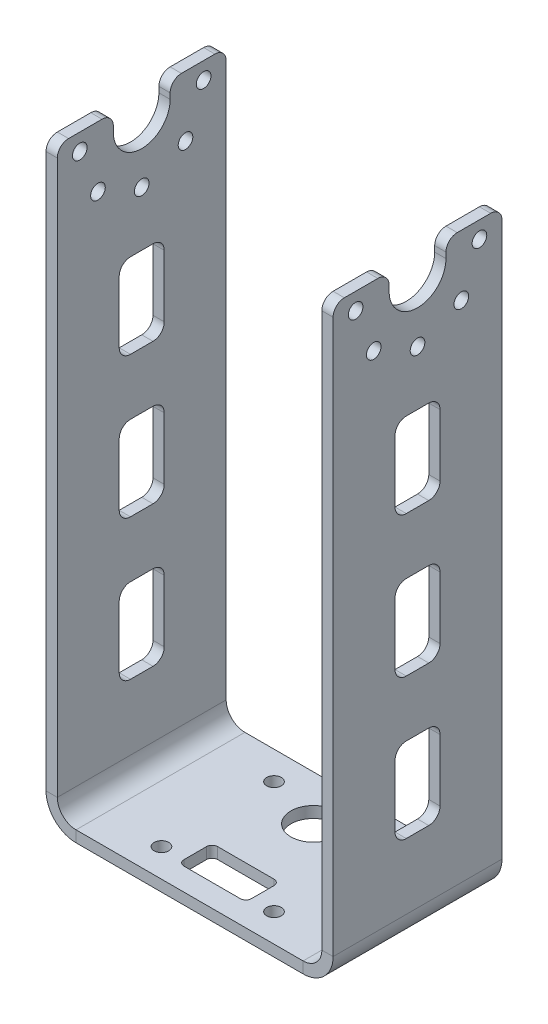
from build123d import *

# Parameters (mm, degrees)
BASE_FLANGE1_DEPTH      = 15
CUT_EXTRUDE1_DEPTH      = 10
CUT_EXTRUDE2_DEPTH      = 108.837563029
CUT_EXTRUDE2_DEPTH_BACK = 108.837563029
SKETCH6_R               = 1.3
SKETCH8_R               = 4
SKETCH8_W               = 12
SKETCH8_H               = 6
CUT_EXTRUDE4_DEPTH      = 10
CUT_EXTRUDE5_DEPTH      = 108.837563029
CUT_EXTRUDE5_DEPTH_BACK = 108.837563029
FILLET1_R               = 2
FILLET2_R               = 1


# Sheet-metal steps are written as plain solids
with BuildPart() as part:
    # Sketch1 → Base-Flange1 (new, symmetric)
    with BuildSketch(Plane.XY):
        with BuildLine():
            Line((-23.5, 103.7), (-23.5, 3.33))
            ThreePointArc((-23.5, 3.33), (-22.524665581, 0.975334419), (-20.17, 0))
            Line((-20.17, 0), (20.17, 0))
            ThreePointArc((20.17, 0), (22.524665581, 0.975334419), (23.5, 3.33))
            Line((23.5, 3.33), (23.5, 103.7))
            Line((23.5, 103.7), (25.5, 103.7))
            Line((25.5, 103.7), (25.5, 3.33))
            ThreePointArc((25.5, 3.33), (23.938879144, -0.438879144), (20.17, -2))
            Line((20.17, -2), (-20.17, -2))
            ThreePointArc((-20.17, -2), (-23.938879144, -0.438879144), (-25.5, 3.33))
            Line((-25.5, 3.33), (-25.5, 103.7))
            Line((-25.5, 103.7), (-23.5, 103.7))
        make_face()
    extrude(amount=BASE_FLANGE1_DEPTH, both=True)

    # Sketch5 → Cut-Extrude1 (cut)
    with BuildSketch(Plane.XZ.offset(2)):
        with BuildLine():
            Line((-10, 8.7), (-10, 10))
            Line((-10, 10), (-8.7, 10))
            ThreePointArc((-8.7, 10), (-10.919238816, 10.919238816), (-10, 8.7))
        make_face()
        with BuildLine():
            Line((-8.7, 10), (-10, 10))
            Line((-10, 10), (-10, 8.7))
            ThreePointArc((-10, 8.7), (-9.080761184, 9.080761184), (-8.7, 10))
        make_face()
        with BuildLine():
            ThreePointArc((11.3, 10), (10, 11.3), (8.7, 10))
            Line((8.7, 10), (10, 10))
            Line((10, 10), (10, 8.7))
            ThreePointArc((10, 8.7), (10.919238816, 9.080761184), (11.3, 10))
        make_face()
        with BuildLine():
            Line((10, 10), (8.7, 10))
            ThreePointArc((8.7, 10), (9.080761184, 9.080761184), (10, 8.7))
            Line((10, 8.7), (10, 10))
        make_face()
        with BuildLine():
            ThreePointArc((11.3, -10), (10.919238816, -9.080761184), (10, -8.7))
            Line((10, -8.7), (10, -10))
            Line((10, -10), (8.7, -10))
            ThreePointArc((8.7, -10), (10, -11.3), (11.3, -10))
        make_face()
        with BuildLine():
            Line((10, -10), (10, -8.7))
            ThreePointArc((10, -8.7), (9.080761184, -9.080761184), (8.7, -10))
            Line((8.7, -10), (10, -10))
        make_face()
        with BuildLine():
            ThreePointArc((-8.7, -10), (-9.080761184, -9.080761184), (-10, -8.7))
            Line((-10, -8.7), (-10, -10))
            Line((-10, -10), (-8.7, -10))
        make_face()
        with BuildLine():
            Line((-10, -10), (-10, -8.7))
            ThreePointArc((-10, -8.7), (-10.919238816, -10.919238816), (-8.7, -10))
            Line((-8.7, -10), (-10, -10))
        make_face()
    extrude(amount=-CUT_EXTRUDE1_DEPTH, mode=Mode.SUBTRACT)

    # Sketch6 → Cut-Extrude2 (cut, two sides: drawn at the far end of the back side and taken through both)
    with BuildSketch(Plane(origin=(0, 0, 0), x_dir=(0, 0, -1), z_dir=(1, 0, 0)).offset(-CUT_EXTRUDE2_DEPTH_BACK)):
        with BuildLine():
            ThreePointArc((-4.062326919, 103.7), (-4.796730707, 102.279200598), (-5.05, 100.7))
            ThreePointArc((-5.05, 100.7), (0, 95.65), (5.05, 100.7))
            ThreePointArc((5.05, 100.7), (4.796730707, 102.279200598), (4.062326919, 103.7))
            Line((4.062326919, 103.7), (-4.062326919, 103.7))
        make_face()
        with BuildLine():
            ThreePointArc((4.062326919, 103.7), (0, 105.75), (-4.062326919, 103.7))
            Line((-4.062326919, 103.7), (4.062326919, 103.7))
        make_face()
        with BuildLine():
            Line((-5.05, 103.7), (-5.05, 100.7))
            ThreePointArc((-5.05, 100.7), (-4.796730707, 102.279200598), (-4.062326919, 103.7))
            Line((-4.062326919, 103.7), (-5.05, 103.7))
        make_face()
        with BuildLine():
            ThreePointArc((4.062326919, 103.7), (4.796730707, 102.279200598), (5.05, 100.7))
            Line((5.05, 100.7), (5.05, 103.7))
            Line((5.05, 103.7), (4.062326919, 103.7))
        make_face()
        with Locations(Location((11, 100.7, 0), (0, 0, 90))):
            Circle(SKETCH6_R)
        with Locations(Location((0, 89.7, 0), (0, 0, 90))):
            Circle(SKETCH6_R)
        with Locations(Location((-7.778174593, 92.921825407, 0), (0, 0, 90))):
            Circle(SKETCH6_R)
        with Locations(Location((7.778174593, 92.921825407, 0), (0, 0, 90))):
            Circle(SKETCH6_R)
        with Locations(Location((-11, 100.7, 0), (0, 0, 90))):
            Circle(SKETCH6_R)
    extrude(amount=CUT_EXTRUDE2_DEPTH + CUT_EXTRUDE2_DEPTH_BACK, mode=Mode.SUBTRACT)

    # Sketch8 → Cut-Extrude4 (cut)
    with BuildSketch(Plane(origin=(0, 0, 0), x_dir=(1, 0, 0), z_dir=(0, 1, 0))):
        with Locations(Location((0, 7, 0), (0, 0, 270))):
            Circle(SKETCH8_R)
        with Locations((0, -8)):
            Rectangle(SKETCH8_W, SKETCH8_H)
    extrude(amount=-CUT_EXTRUDE4_DEPTH, mode=Mode.SUBTRACT)

    # Sketch9 → Cut-Extrude5 (cut, two sides: drawn at the far end of the back side and taken through both)
    with BuildSketch(Plane(origin=(0, 0, 0), x_dir=(0, 0, -1), z_dir=(1, 0, 0)).offset(-CUT_EXTRUDE5_DEPTH_BACK)):
        with BuildLine():
            Line((-2, 40), (2, 40))
            ThreePointArc((2, 40), (3.414213562, 40.585786438), (4, 42))
            Line((4, 42), (4, 53))
            ThreePointArc((4, 53), (3.414213562, 54.414213562), (2, 55))
            Line((2, 55), (-2, 55))
            ThreePointArc((-2, 55), (-3.414213562, 54.414213562), (-4, 53))
            Line((-4, 53), (-4, 42))
            ThreePointArc((-4, 42), (-3.414213562, 40.585786438), (-2, 40))
        make_face()
        with BuildLine():
            Line((-2, 15), (2, 15))
            ThreePointArc((2, 15), (3.414213562, 15.585786438), (4, 17))
            Line((4, 17), (4, 28))
            ThreePointArc((4, 28), (3.414213562, 29.414213562), (2, 30))
            Line((2, 30), (-2, 30))
            ThreePointArc((-2, 30), (-3.414213562, 29.414213562), (-4, 28))
            Line((-4, 28), (-4, 17))
            ThreePointArc((-4, 17), (-3.414213562, 15.585786438), (-2, 15))
        make_face()
        with BuildLine():
            Line((-2, 65), (2, 65))
            ThreePointArc((2, 65), (3.414213562, 65.585786438), (4, 67))
            Line((4, 67), (4, 78))
            ThreePointArc((4, 78), (3.414213562, 79.414213562), (2, 80))
            Line((2, 80), (-2, 80))
            ThreePointArc((-2, 80), (-3.414213562, 79.414213562), (-4, 78))
            Line((-4, 78), (-4, 67))
            ThreePointArc((-4, 67), (-3.414213562, 65.585786438), (-2, 65))
        make_face()
    extrude(amount=CUT_EXTRUDE5_DEPTH + CUT_EXTRUDE5_DEPTH_BACK, mode=Mode.SUBTRACT)

    # Fillet1
    fillet1_edges = [part.edges().sort_by_distance(p)[0] for p in [
        (-24.5, 103.7, -15),
        (24.5, 103.7, -15),
        (-24.5, 103.7, 15),
        (24.5, 103.7, 15),
        (24.5, 103.7, -5.05),
        (24.5, 103.7, 5.05),
        (-24.5, 103.7, -5.05),
        (-24.5, 103.7, 5.05),
    ]]
    fillet(fillet1_edges, radius=FILLET1_R)

    # Fillet2
    fillet2_edges = [part.edges().sort_by_distance(p)[0] for p in [
        (-6, -1, 11),
        (-6, -1, 5),
        (6, -1, 5),
        (6, -1, 11),
    ]]
    fillet(fillet2_edges, radius=FILLET2_R)


solid = part.part
